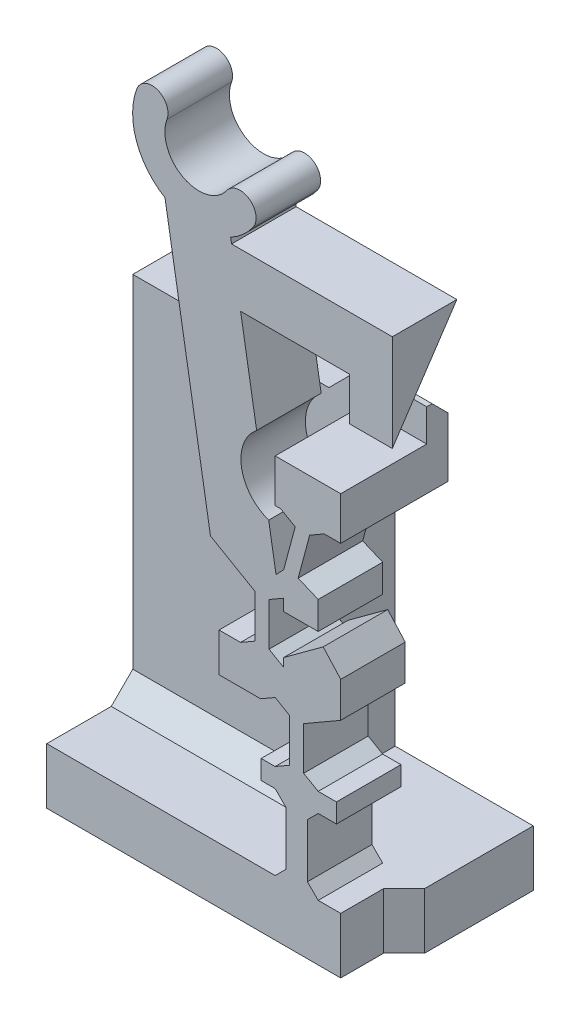
from build123d import *

# Parameters (mm, degrees)
BOSS_SWITCH_BODY_DEPTH                    = 3
SKETCH1_W                                 = 4
SKETCH1_H                                 = 3.5
BOSS_FLANGE_WIDTH_DEPTH                   = 5
BOSS_FLANGE_HEIGHT_REACH                  = 35.863
SKETCH2_W                                 = 4
SKETCH2_H                                 = 2
SKETCH2_W_2                               = 8
SKETCH2_H_2                               = 2.602328973
CUT_UP_TO_DOWN_DERAILLEUR_CLEARANCE_REACH = 22.316
SKETCH10_W                                = 2.453096586
SKETCH10_H                                = 3
SKETCH17_W                                = 12.1675
SKETCH17_H                                = 4
BOSS_FLANGE_SUPPORT_DEPTH                 = 14.897671027
TAP_DRILL_FOR_M2X0_4_TAP1_D               = 1.6
M2_CLEARANCE_HOLE2_D                      = 2.4
M2_CLEARANCE_HOLE2_DEPTH                  = 15
M2_CLEARANCE_HOLE2_TIP                    = 0.721032743
CHAMFER_FLANGE_SUPPORT_SIZE               = 1.5
CHAMFER_FLANGE_SUPPORT_2_SIZE             = 1.5
SKETCH23_W                                = 3.9675
SKETCH23_H                                = 13.397671027
CUT_GAP_FOR_PRINTING_DEPTH                = 32.000499688
CHAMFER_FLANGE_SUPPORT_3_SIZE             = 1
SKETCH25_W                                = 0.953096586
SKETCH25_H                                = 3.5
CUT_DERAILLEUR_CLEARANCE_DEPTH            = 32.145320369
CHAMFER8_SIZE                             = 1
CUT_UP_TO_DOWN_CANTILEVER_SLOPE_REACH     = 31.869
SKETCH26_W                                = 12.477246204
SKETCH26_H                                = 5.771077126
CUT_WIDE_DERAILLEUR_CLEARANCE_DEPTH       = 33.195879702
CUT_WIDE_DERAILLEUR_CLEARANCE_DEPTH_BACK  = 4
SKETCH27_W                                = 2.5
SKETCH27_H                                = 5.000000046
CHAMFER9_SIZE                             = 1.25
SKETCH28_W                                = 3.046903414
SKETCH28_H                                = 1.5
CUT_EXTRUDE1_DEPTH                        = 1


# Some blends are built 0.0001 mm under size
with BuildPart() as part:
    # Sketch-SwitchBossUp → Boss-Switch Body (new body)
    with BuildSketch(Plane.XY):
        with BuildLine():
            Line((5.581091201, 12.55524379), (5.581100766, 11.263016279))
            Line((5.581100766, 11.263016279), (3.971265023, 11.263016279))
            Line((3.971265023, 11.263016279), (3.97126394, 11.79911022))
            Line((3.97126394, 11.79911022), (3.296271341, 11.409403061))
            Line((3.296271341, 11.409403061), (3.296271341, 9.409403061))
            Line((3.296271341, 9.409403061), (3.971278743, 9.019687356))
            Line((3.971278743, 9.019687356), (3.971278743, 9.409408058))
            Line((3.971278743, 9.409408058), (5.815189336, 10.763016279))
            Line((5.815189336, 10.763016279), (6.627976927, 9.860324207))
            Line((6.627976927, 9.860324207), (6.627976927, 8.210536505))
            Line((6.627976927, 8.210536505), (5.581127833, 7.606137899))
            Line((5.581127833, 7.606137899), (4.906138119, 7.216432406))
            Line((4.906138119, 7.216432406), (4.906138119, 5.216432406))
            Line((4.906138119, 5.216432406), (5.58114552, 4.826716701))
            Line((5.58114552, 4.826716701), (6.430577026, 4.826716701))
            Line((6.430577026, 4.826716701), (6.430577026, 3.937018274))
            Line((6.430577026, 3.937018274), (5.581138119, 3.937018274))
            Line((5.581138119, 3.937018274), (5.081138119, 3.437018274))
            Line((5.081138119, 3.437018274), (5.081138119, 0.937018274))
            Line((5.081138119, 0.937018274), (5.581138119, 0.437018274))
            Line((5.581138119, 0.437018274), (6.627976927, 0.437018274))
            Line((6.627976927, 0.437018274), (6.627976927, -2.165310699))
            Line((6.627976927, -2.165310699), (3.034464198, -2.165310699))
            Line((3.034464198, -2.165310699), (3.034464198, 0.437018274))
            Line((3.034464198, 0.437018274), (3.581138119, 0.437018274))
            Line((3.581138119, 0.437018274), (4.081138119, 0.937018274))
            Line((4.081138119, 0.937018274), (4.081138119, 3.437018274))
            Line((4.081138119, 3.437018274), (3.581138119, 3.937018274))
            Line((3.581138119, 3.937018274), (2.930577026, 3.937018274))
            Line((2.930577026, 3.937018274), (2.930577026, 4.826720436))
            Line((2.930577026, 4.826720436), (3.58114552, 4.826720436))
            Line((3.58114552, 4.826720436), (4.256138119, 5.216427595))
            Line((4.256138119, 5.216427595), (4.256138119, 7.216427595))
            Line((4.256138119, 7.216427595), (3.581130717, 7.6061433))
            Line((3.581130717, 7.6061433), (2.9061262, 7.216422599))
            Line((2.9061262, 7.216422599), (0.971281627, 7.216422599))
            Line((0.971281627, 7.216422599), (0.971281627, 9.019692757))
            Line((0.971281627, 9.019692757), (1.971281627, 9.019692757))
            Line((1.971281627, 9.019692757), (2.646271341, 9.40939825))
            Line((2.646271341, 9.40939825), (2.646271341, 11.40939825))
            Line((2.646271341, 11.40939825), (1.696557212, 11.957715958))
            Line((1.696557212, 11.957715958), (0.573317845, 12.60621851))
            Line((0.573317845, 12.60621851), (-1.541303694, 25.167805745))
            ThreePointArc((-1.541303694, 25.167805745), (-2.872284003, 26.795385437), (-2.852546321, 28.897797067))
            ThreePointArc((-2.852546321, 28.897797067), (-1.887813913, 29.338582026), (-1.447028953, 28.373849618))
            ThreePointArc((-1.447028953, 28.373849618), (-0.703448682, 26.416936722), (1.333779254, 26.898727173))
            ThreePointArc((1.333779254, 26.898727173), (2.379722745, 27.074801628), (2.555797201, 26.028858137))
            ThreePointArc((2.555797201, 26.028858137), (2.086504637, 25.507104397), (1.511513111, 25.104801997))
            Line((1.511513111, 25.104801997), (1.553598189, 24.854801997))
            Line((1.553598189, 24.854801997), (9.027976927, 24.854801997))
            Line((9.027976927, 24.854801997), (9.027976927, 22.354801997))
            Line((9.027976927, 22.354801997), (9.027976927, 20.354801997))
            Line((9.027976927, 20.354801997), (7.027976927, 20.354801997))
            Line((7.027976927, 20.354801997), (7.027976927, 22.354801997))
            Line((7.027976927, 22.354801997), (1.974448974, 22.354801997))
            Line((1.974448974, 22.354801997), (2.719778232, 17.927287042))
            ThreePointArc((2.719778232, 17.927287042), (2.013826204, 16.096957693), (3.280124137, 14.598637521))
            Line((3.280124137, 14.598637521), (3.620297651, 12.577888564))
            Line((3.620297651, 12.577888564), (3.976674365, 12.944956135))
            Line((3.976674365, 12.944956135), (4.512557947, 14.944960101))
            Line((4.512557947, 14.944960101), (3.837515632, 15.334689301))
            Line((3.837515632, 15.334689301), (3.581073513, 15.334689301))
            Line((3.581073513, 15.334689301), (3.581073513, 17.334689301))
            Line((3.581073513, 17.334689301), (5.725580434, 17.334689301))
            Line((5.725580434, 17.334689301), (6.627976927, 17.334689301))
            Line((6.627976927, 17.334689301), (6.627976927, 15.334689301))
            Line((6.627976927, 15.334689301), (5.860498075, 15.334689301))
            Line((5.860498075, 15.334689301), (5.185487464, 14.944965082))
            Line((5.185487464, 14.944965082), (4.649603883, 12.944961115))
            Line((4.649603883, 12.944961115), (5.581091201, 12.55524379))
        make_face()
    extrude(amount=BOSS_SWITCH_BODY_DEPTH)

    # Sketch1 → Boss-Flange Width (add)
    with BuildSketch(Plane(origin=(0, 0, 0), x_dir=(-1, 0, 0), z_dir=(0, 0, -1))):
        Polygon((-7.581073513, -2.165310699), (0.412170615, -2.165310699), (0.412170615, 0.437018274), (-3.034464198, 0.437018274), (-3.581138119, 0.437018274), (-5.081138119, 0.437018274), (-6.627976927, 0.437018274), (-7.581073513, 0.437018274), align=None)
        with Locations((-5.581073513, 17.084689301)):
            Rectangle(SKETCH1_W, SKETCH1_H)
    extrude(amount=BOSS_FLANGE_WIDTH_DEPTH)

    # Sketch2 → Boss-Flange Height (add, up to next)
    with BuildSketch(Plane(origin=(-7.039523073, 0, 0), x_dir=(0, 0, -1), z_dir=(1, 0, 0)), mode=Mode.PRIVATE) as boss_flange_height_sk1:
        with Locations((3, 16.334689301)):
            Rectangle(SKETCH2_W, SKETCH2_H)
    boss_flange_height_tool1 = extrude(boss_flange_height_sk1.sketch, amount=BOSS_FLANGE_HEIGHT_REACH, mode=Mode.PRIVATE) - part.part
    # Sketch2 → Boss-Flange Height (add, up to next)
    with BuildSketch(Plane(origin=(-7.039523073, 0, 0), x_dir=(0, 0, -1), z_dir=(1, 0, 0)), mode=Mode.PRIVATE) as boss_flange_height_sk2:
        with Locations((1, -0.864146212)):
            Rectangle(SKETCH2_W_2, SKETCH2_H_2)
    boss_flange_height_tool2 = extrude(boss_flange_height_sk2.sketch, amount=BOSS_FLANGE_HEIGHT_REACH, mode=Mode.PRIVATE) - part.part
    add(boss_flange_height_tool1.solids().sort_by_distance((-7.039523, 16.334689, -3))[0])
    add(boss_flange_height_tool2.solids().sort_by_distance((-7.039523, -0.864146, -1))[0])

    # Sketch10 → Cut-Up-To-Down Derailleur Clearance (cut, up to next)
    with BuildSketch(Plane(origin=(0, 15.334689301, 0), x_dir=(1, 0, 0), z_dir=(0, 1, 0)), mode=Mode.PRIVATE) as cut_up_to_down_derailleur_clearance_sk1:
        with Locations((6.35452522, 3.5)):
            Rectangle(SKETCH10_W, SKETCH10_H)
    cut_up_to_down_derailleur_clearance_tool1 = extrude(cut_up_to_down_derailleur_clearance_sk1.sketch, amount=CUT_UP_TO_DOWN_DERAILLEUR_CLEARANCE_REACH, mode=Mode.PRIVATE) & part.part
    add(cut_up_to_down_derailleur_clearance_tool1.solids().sort_by_distance((6.354525, 15.334689, -3.5))[0], mode=Mode.SUBTRACT)

    # Sketch17 → Boss-Flange Support (add)
    with BuildSketch(Plane.XZ.offset(-15.334689301)):
        with Locations((-0.955773073, -3)):
            Rectangle(SKETCH17_W, SKETCH17_H)
    extrude(amount=BOSS_FLANGE_SUPPORT_DEPTH)

    # Tap Drill for M2x0.4 Tap1 (through all)
    with Locations(Plane(origin=(0, -2.165310699, 0), x_dir=(-1, 0, 0), z_dir=(0, -1, 0))):
        with Locations((5.039523073, 3), (0.539523073, 3)):
            Hole(TAP_DRILL_FOR_M2X0_4_TAP1_D / 2)

    # M2 Clearance Hole2
    with Locations(Plane.XZ.offset(2.165310699)):
        with Locations((-5.039523073, -3), (-0.539523073, -3)):
            Hole(M2_CLEARANCE_HOLE2_D / 2, depth=M2_CLEARANCE_HOLE2_DEPTH)
            with Locations((0, 0, -(M2_CLEARANCE_HOLE2_DEPTH + M2_CLEARANCE_HOLE2_TIP / 2))):  # 118° drill point
                Cone(0, M2_CLEARANCE_HOLE2_D / 2, M2_CLEARANCE_HOLE2_TIP, mode=Mode.SUBTRACT)

    # Chamfer-Flange Support
    chamfer_flange_support_edges = [part.edges().sort_by_distance(p)[0] for p in [
        (3.581073513, 17.334689301, -3),
    ]]
    chamfer(chamfer_flange_support_edges, length=CHAMFER_FLANGE_SUPPORT_SIZE - 0.0001)  # a hair under: the kernel refuses the full size

    # Chamfer-Flange Support 2
    chamfer_flange_support_2_edges = [part.edges().sort_by_distance(p)[0] for p in [
        (5.127976927, 17.084689301, -2),
        (5.127976927, 15.334689301, -1.5),
    ]]
    chamfer(chamfer_flange_support_2_edges, length=CHAMFER_FLANGE_SUPPORT_2_SIZE)

    # Sketch23 → Cut-Gap for Printing (cut, through all)
    with BuildSketch(Plane.XY.offset(-1)):
        with Locations((3.144226927, 7.135853788)):
            Rectangle(SKETCH23_W, SKETCH23_H)
    extrude(amount=-CUT_GAP_FOR_PRINTING_DEPTH, mode=Mode.SUBTRACT)

    # Chamfer-Flange Support 3
    chamfer_flange_support_3_edges = [part.edges().sort_by_distance(p)[0] for p in [
        (-2.939523073, 0.437018274, -1),
    ]]
    chamfer(chamfer_flange_support_3_edges, length=CHAMFER_FLANGE_SUPPORT_3_SIZE)

    # Sketch25 → Cut-Derailleur Clearance (cut, through all)
    with BuildSketch(Plane.XY):
        with Locations((7.10452522, 17.084689301)):
            Rectangle(SKETCH25_W, SKETCH25_H)
    extrude(amount=-CUT_DERAILLEUR_CLEARANCE_DEPTH, mode=Mode.SUBTRACT)

    # Chamfer8
    # the kernel refuses this chamfer: 1 mm, written as the material it adds along each edge
    with BuildSketch(Plane(origin=(6.627976927, 0.437018274, 0), x_dir=(0.9996219169112968, 0, -0.027495876610586365), z_dir=(0, -1, 0))) as chamfer8_piece_1_section:
        Polygon((CHAMFER8_SIZE * 0.999621916911, CHAMFER8_SIZE * 0.0274958766106), (-CHAMFER8_SIZE * 0.0274958766106, CHAMFER8_SIZE * 0.999621916911), (0, 0), align=None)
    chamfer8_piece_1 = extrude(amount=2.602328973, mode=Mode.PRIVATE)
    chamfer8_piece_1 = split(chamfer8_piece_1, bisect_by=Plane(origin=(7.581073513, -0.864146212, 0.332375145), z_dir=(-1, 0, 0)), keep=Keep.TOP, mode=Mode.PRIVATE)
    add(chamfer8_piece_1)

    # Sketch26 → Cut-Up-to-Down Cantilever Slope (cut, up to next)
    with BuildSketch(Plane(origin=(-3.086642121, 5.589000146, 8.383500218), x_dir=(-0.9561404375276108, -0.1624764728289173, -0.24371470924337582), z_dir=(0.2929086269205964, -0.5303712883154423, -0.795556932473163)), mode=Mode.PRIVATE) as cut_up_to_down_cantilever_slope_sk1:
        with Locations((-13.791615152, 17.794906754)):
            Rectangle(SKETCH26_W, SKETCH26_H)
    cut_up_to_down_cantilever_slope_tool1 = extrude(cut_up_to_down_cantilever_slope_sk1.sketch, amount=CUT_UP_TO_DOWN_CANTILEVER_SLOPE_REACH, mode=Mode.PRIVATE) & part.part
    add(cut_up_to_down_cantilever_slope_tool1.solids().sort_by_distance((10.100079, 22.636071, 1.873881))[0], mode=Mode.SUBTRACT)

    # Sketch27 → Cut-Wide Derailleur Clearance (cut, two sides: drawn at the far end of the back side and taken through both)
    with BuildSketch(Plane(origin=(5.127976927, 0, 0), x_dir=(0, 0, -1), z_dir=(1, 0, 0)).offset(-CUT_WIDE_DERAILLEUR_CLEARANCE_DEPTH_BACK)):
        with Locations((3.75, 16.334689324)):
            Rectangle(SKETCH27_W, SKETCH27_H)
    extrude(amount=CUT_WIDE_DERAILLEUR_CLEARANCE_DEPTH + CUT_WIDE_DERAILLEUR_CLEARANCE_DEPTH_BACK, mode=Mode.SUBTRACT)

    # Chamfer9
    chamfer9_edges = [part.edges().sort_by_distance(p)[0] for p in [
        (4.85452522, 18.834689347, -2.5),
    ]]
    chamfer(chamfer9_edges, length=CHAMFER9_SIZE)

    # Sketch28 → Cut-Extrude1 (cut)
    with BuildSketch(Plane.XY.offset(-1)):
        with Locations((5.10452522, 18.084689301)):
            Rectangle(SKETCH28_W, SKETCH28_H)
    extrude(amount=CUT_EXTRUDE1_DEPTH, mode=Mode.SUBTRACT)


solid = part.part
